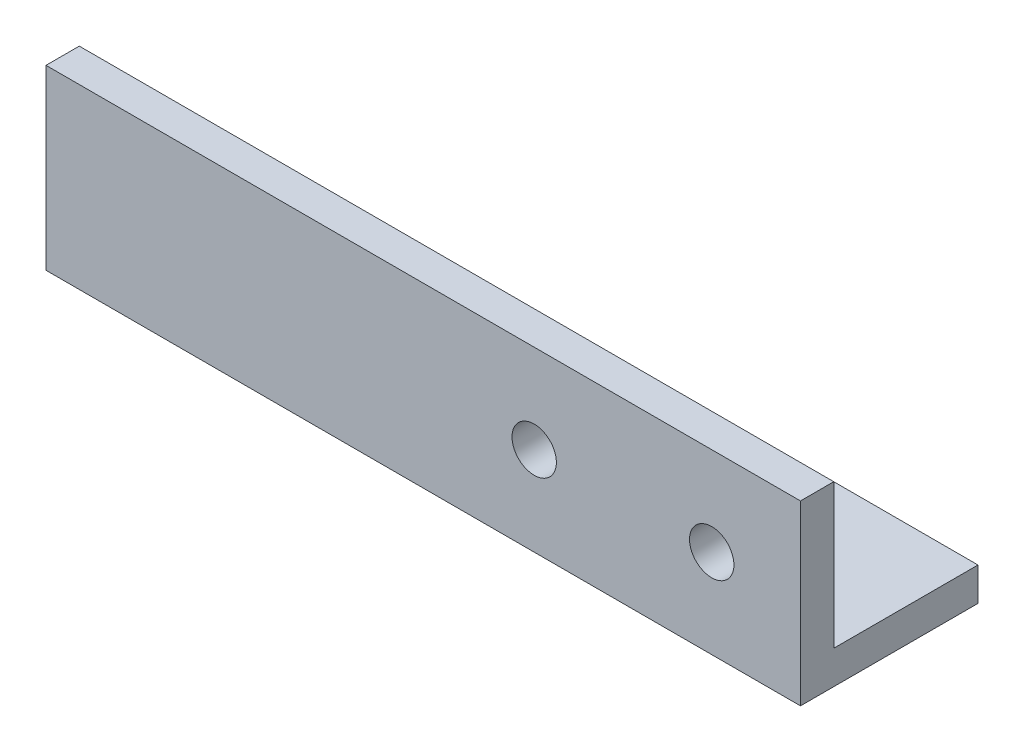
from build123d import *

# Parameters (mm, degrees)
BOSS_EXTRUDE1_DEPTH = 107.95
CUT_EXTRUDE1_REACH  = 114.802
SKETCH2_R           = 3.175
CUT_EXTRUDE2_REACH  = 115.77
SKETCH3_R           = 3.175
CUT_EXTRUDE3_REACH  = 115.77
SKETCH6_R           = 3.175


with BuildPart() as part:
    # Sketch1 → Boss-Extrude1 (new body)
    with BuildSketch(Plane(origin=(0, 0, 0), x_dir=(0, 0, -1), z_dir=(1, 0, 0))):
        Polygon((0, 0), (0, -25.4), (25.4, -25.4), (25.4, -20.6375), (4.7625, -20.6375), (4.7625, 0), align=None)
    extrude(amount=BOSS_EXTRUDE1_DEPTH)

    # Sketch2 → Cut-Extrude1 (cut, up to next)
    with BuildSketch(Plane(origin=(0, -20.6375, 0), x_dir=(1, 0, 0), z_dir=(0, 1, 0)), mode=Mode.PRIVATE) as cut_extrude1_sk1:
        with Locations((9.525, 11.1125)):
            Circle(SKETCH2_R)
    cut_extrude1_tool1 = extrude(cut_extrude1_sk1.sketch, amount=-CUT_EXTRUDE1_REACH, mode=Mode.PRIVATE) & part.part
    # Sketch2 → Cut-Extrude1 (cut, up to next)
    with BuildSketch(Plane(origin=(0, -20.6375, 0), x_dir=(1, 0, 0), z_dir=(0, 1, 0)), mode=Mode.PRIVATE) as cut_extrude1_sk2:
        with Locations((19.05, 17.4625)):
            Circle(SKETCH2_R)
    cut_extrude1_tool2 = extrude(cut_extrude1_sk2.sketch, amount=-CUT_EXTRUDE1_REACH, mode=Mode.PRIVATE) & part.part
    add(cut_extrude1_tool1.solids().sort_by_distance((9.525, -20.6375, -11.1125))[0], mode=Mode.SUBTRACT)
    add(cut_extrude1_tool2.solids().sort_by_distance((19.05, -20.6375, -17.4625))[0], mode=Mode.SUBTRACT)

    # Sketch3 → Cut-Extrude2 (cut, up to next)
    with BuildSketch(Plane.XZ.offset(25.4), mode=Mode.PRIVATE) as cut_extrude2_sk1:
        with Locations((76.332177029, -13.470384182)):
            Circle(SKETCH3_R)
    cut_extrude2_tool1 = extrude(cut_extrude2_sk1.sketch, amount=-CUT_EXTRUDE2_REACH, mode=Mode.PRIVATE) & part.part
    add(cut_extrude2_tool1.solids().sort_by_distance((76.332177, -25.4, -13.470384))[0], mode=Mode.SUBTRACT)

    # Sketch6 → Cut-Extrude3 (cut, up to next)
    with BuildSketch(Plane.XY, mode=Mode.PRIVATE) as cut_extrude3_sk1:
        with Locations((69.85, -12.7)):
            Circle(SKETCH6_R)
    cut_extrude3_tool1 = extrude(cut_extrude3_sk1.sketch, amount=-CUT_EXTRUDE3_REACH, mode=Mode.PRIVATE) & part.part
    # Sketch6 → Cut-Extrude3 (cut, up to next)
    with BuildSketch(Plane.XY, mode=Mode.PRIVATE) as cut_extrude3_sk2:
        with Locations((95.25, -12.7)):
            Circle(SKETCH6_R)
    cut_extrude3_tool2 = extrude(cut_extrude3_sk2.sketch, amount=-CUT_EXTRUDE3_REACH, mode=Mode.PRIVATE) & part.part
    add(cut_extrude3_tool1.solids().sort_by_distance((69.85, -12.7, 0))[0], mode=Mode.SUBTRACT)
    add(cut_extrude3_tool2.solids().sort_by_distance((95.25, -12.7, 0))[0], mode=Mode.SUBTRACT)


solid = part.part
